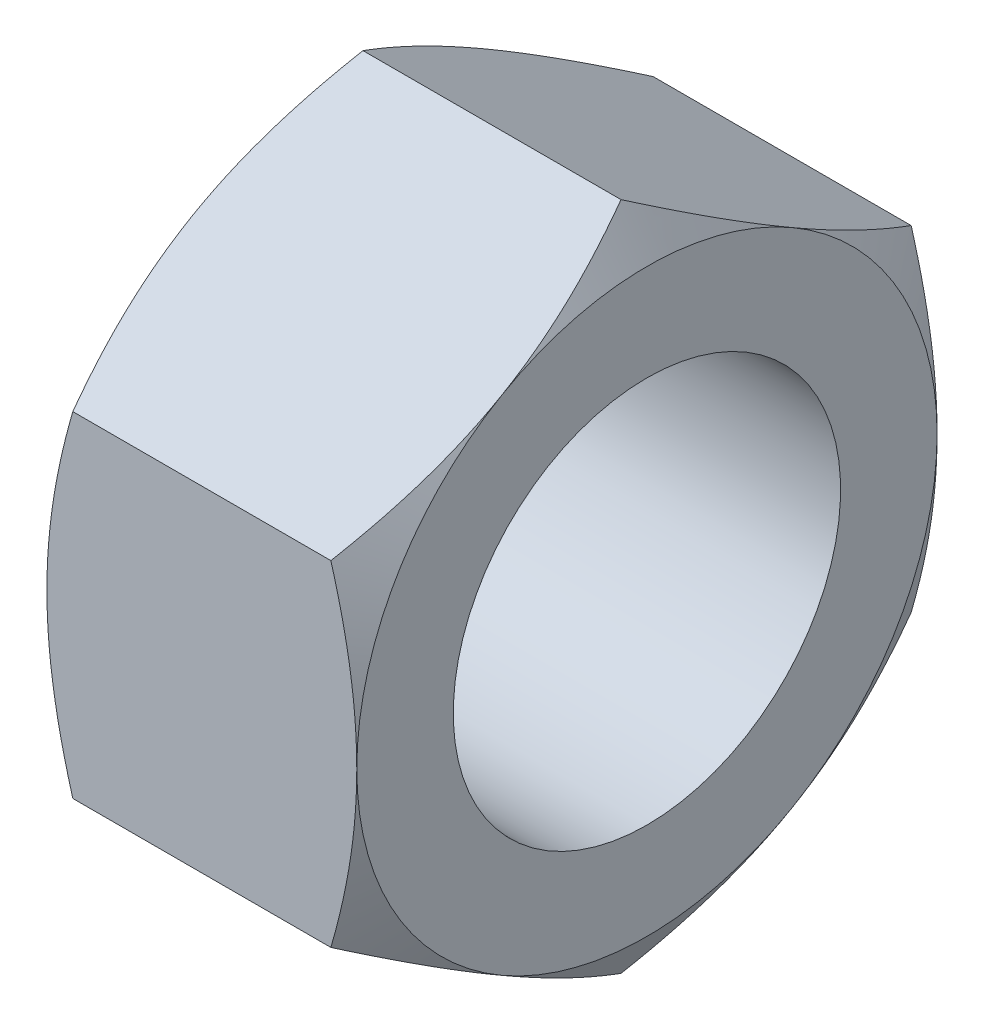
from build123d import *

# Parameters (mm, degrees)
CROQUIS1_W            = 6.4
CROQUIS1_H            = 6.92
CORTAR_EXTRUIR1_DEPTH = 7
CROQUIS3_OUTSIDE_W    = 42.114
CROQUIS3_OUTSIDE_H    = 43.968
CROQUIS3_OUTSIDE_R    = 5.992895794
CORTAR_EXTRUIR2_DEPTH = 7
CORTAR_EXTRUIR2_DRAFT = -60
CROQUIS5_OUTSIDE_W    = 21.33
CROQUIS5_OUTSIDE_H    = 23.184
CROQUIS5_OUTSIDE_R    = 5.992895794
CORTAR_EXTRUIR3_DEPTH = 1
CORTAR_EXTRUIR3_DRAFT = -60
CROQUIS6_R            = 4
CORTAR_EXTRUIR4_DEPTH = 7


with BuildPart() as part:
    # Croquis1 → Revolución1 (revolve)
    with BuildSketch(Plane.XY):
        with Locations((3.2, 3.46)):
            Rectangle(CROQUIS1_W, CROQUIS1_H)
    revolve(axis=Axis((6.4, 0, 0), (-1, 0, 0)))

    # Croquis2 → Cortar-Extruir1 (cut)
    with BuildSketch(Plane(origin=(6.4, 0, 0), x_dir=(0, 0, -1), z_dir=(1, 0, 0))):
        with BuildLine():
            ThreePointArc((5.992895794, 3.46), (3.46, 5.992895794), (0, 6.92))
            Line((0, 6.92), (5.992895794, 3.46))
        make_face()
        with BuildLine():
            Line((-5.992895794, 3.46), (0, 6.92))
            ThreePointArc((0, 6.92), (-3.46, 5.992895794), (-5.992895794, 3.46))
        make_face()
        with BuildLine():
            Line((-5.992895794, -3.46), (-5.992895794, 3.46))
            ThreePointArc((-5.992895794, 3.46), (-6.92, 0), (-5.992895794, -3.46))
        make_face()
        with BuildLine():
            ThreePointArc((5.992895794, -3.46), (6.92, 0), (5.992895794, 3.46))
            Line((5.992895794, 3.46), (5.992895794, -3.46))
        make_face()
        with BuildLine():
            Line((0, -6.92), (-5.992895794, -3.46))
            ThreePointArc((-5.992895794, -3.46), (-3.46, -5.992895794), (0, -6.92))
        make_face()
        with BuildLine():
            ThreePointArc((0, -6.92), (3.46, -5.992895794), (5.992895794, -3.46))
            Line((5.992895794, -3.46), (0, -6.92))
        make_face()
    extrude(amount=-CORTAR_EXTRUIR1_DEPTH, mode=Mode.SUBTRACT)


with BuildPart() as cortar_extruir2_tool:
    # Croquis3 outside → Cortar-Extruir2 (with draft: the straight prism first)
    with BuildSketch(Plane(origin=(6.4, 0, 0), x_dir=(0, 0, -1), z_dir=(1, 0, 0))):
        Rectangle(CROQUIS3_OUTSIDE_W, CROQUIS3_OUTSIDE_H)
        Circle(CROQUIS3_OUTSIDE_R, mode=Mode.SUBTRACT)
    extrude(amount=-CORTAR_EXTRUIR2_DEPTH)
    # Cortar-Extruir2: the draft: its side faces are tilted about the plane it starts from
    cortar_extruir2_sides = [cortar_extruir2_tool.faces().sort_by_distance(p)[0] for p in [
        (2.9, -21.984, 0),
        (2.9, 0, -21.057),
        (2.9, 21.984, 0),
        (2.9, 0, 21.057),
        (2.9, 0, 5.992895794),
    ]]
    draft(cortar_extruir2_sides, Plane(origin=(6.4, 0, 0), x_dir=(0, 0, -1), z_dir=(1, 0, 0)), CORTAR_EXTRUIR2_DRAFT)


with BuildPart() as part_1:
    add(part.part)

    # Cortar-Extruir2: cut by cortar_extruir2_tool
    add(cortar_extruir2_tool.part, mode=Mode.SUBTRACT)


with BuildPart() as cortar_extruir3_tool:
    # Croquis5 outside → Cortar-Extruir3 (with draft: the straight prism first)
    with BuildSketch(Plane.ZY):
        Rectangle(CROQUIS5_OUTSIDE_W, CROQUIS5_OUTSIDE_H)
        Circle(CROQUIS5_OUTSIDE_R, mode=Mode.SUBTRACT)
    extrude(amount=-CORTAR_EXTRUIR3_DEPTH)
    # Cortar-Extruir3: the draft: its side faces are tilted about the plane it starts from
    cortar_extruir3_sides = [cortar_extruir3_tool.faces().sort_by_distance(p)[0] for p in [
        (0.5, -11.592, 0),
        (0.5, 0, 10.665),
        (0.5, 11.592, 0),
        (0.5, 0, -10.665),
        (0.5, 0, -5.992895794),
    ]]
    draft(cortar_extruir3_sides, Plane.ZY, CORTAR_EXTRUIR3_DRAFT)


with BuildPart() as part_2:
    add(part_1.part)

    # Cortar-Extruir3: cut by cortar_extruir3_tool
    add(cortar_extruir3_tool.part, mode=Mode.SUBTRACT)

    # Croquis6 → Cortar-Extruir4 (cut)
    with BuildSketch(Plane(origin=(6.4, 0, 0), x_dir=(0, 0, -1), z_dir=(1, 0, 0))):
        Circle(CROQUIS6_R)
    extrude(amount=-CORTAR_EXTRUIR4_DEPTH, mode=Mode.SUBTRACT)


solid = part_2.part
